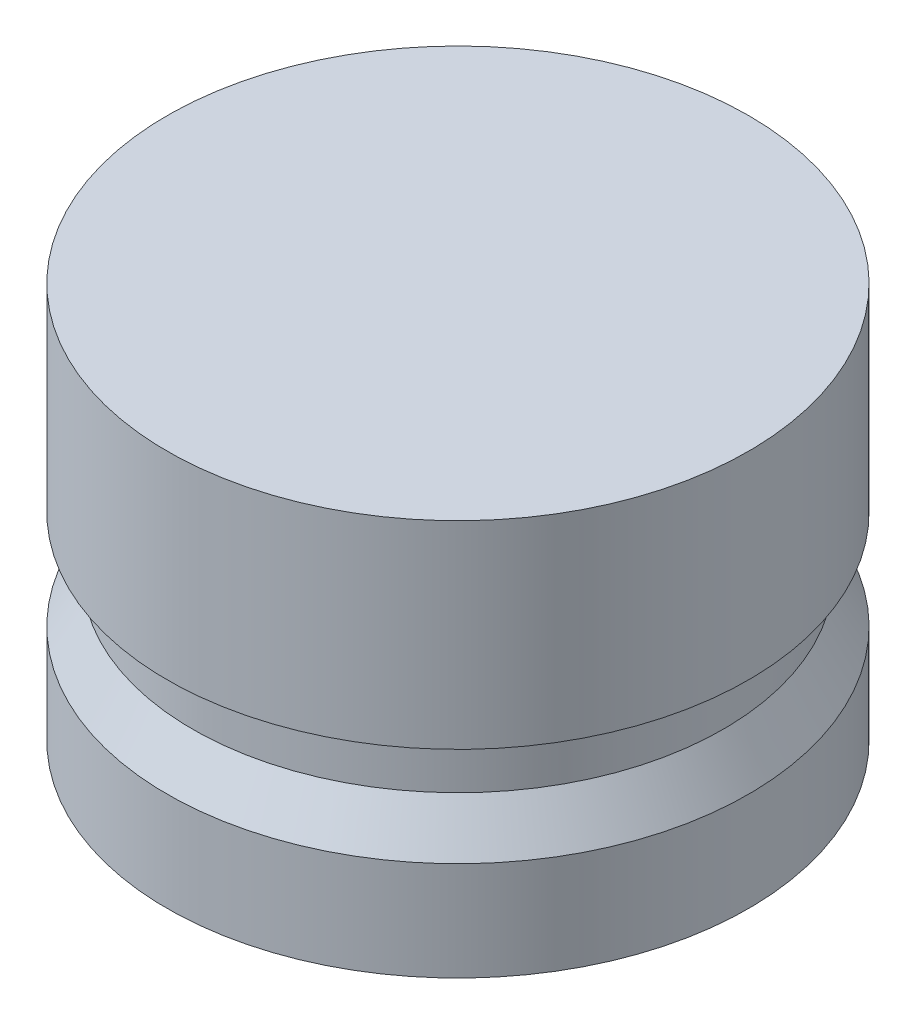
from build123d import *


with BuildPart() as part:
    # Sketch1 → Revolve1 (revolve)
    with BuildSketch(Plane.XY):
        Polygon((0, 0), (-9.3218, 0), (-9.3218, 3.175), (-8.509, 4.572), (-8.509, 6.35), (-9.3218, 6.35), (-9.3218, 12.7), (0, 12.7), align=None)
    revolve(axis=Axis((0, 0, 0), (0, 1, 0)))


solid = part.part
